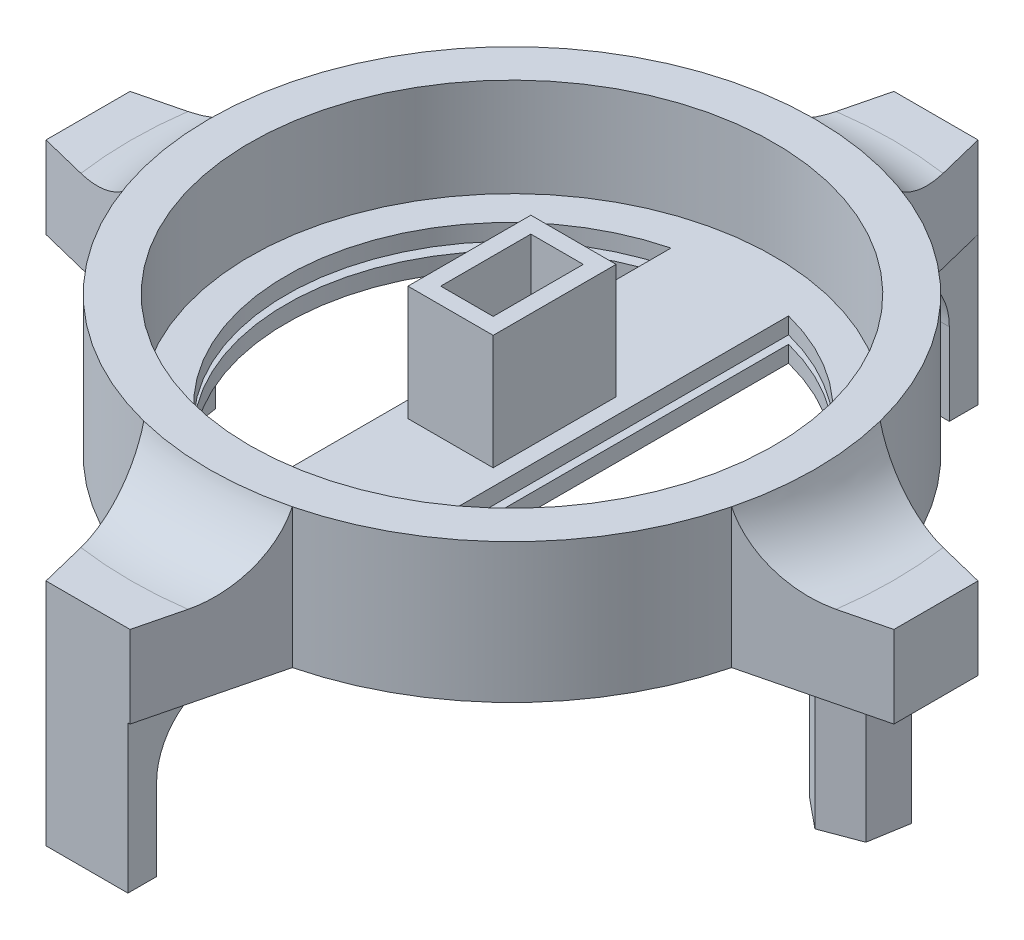
from build123d import *

# Parameters (mm, degrees)
SKETCH4_R                = 17
BOSS_EXTRUDE3_DEPTH      = 6
SHELL4_T                 = 0.5
SKETCH5_W                = 3.2
SKETCH5_H                = 5.5
BOSS_EXTRUDE4_DEPTH      = 8
SHELL5_T                 = 1
BOSS_EXTRUDE6_DEPTH      = 3.5
BOSS_EXTRUDE6_DEPTH_BACK = 1.5
SKETCH7_W                = 5
SKETCH7_H                = 1.75
BOSS_EXTRUDE7_DEPTH      = 9
FILLET3_R                = 5
CUT_EXTRUDE1_DEPTH       = 5
SKETCH13_W               = 3.166032567
SKETCH13_H               = 5.463514234
CUT_EXTRUDE2_DEPTH       = 5
FILLET4_R                = 4
BOSS_EXTRUDE8_DEPTH      = 8


with BuildPart() as part:
    # Sketch4 → Boss-Extrude3 (new body)
    with BuildSketch(Plane(origin=(0, 0, 0), x_dir=(1, 0, 0), z_dir=(0, 1, 0))):
        with Locations(Location((0, -46.79046007, 0), (0, 0, 270))):
            Circle(SKETCH4_R)
    extrude(amount=BOSS_EXTRUDE3_DEPTH)

    # Shell4
    shell4_openings = [part.faces().sort_by_distance(p)[0] for p in [
        (0, 6, 46.79046007),
    ]]
    offset(amount=SHELL4_T, openings=shell4_openings, kind=Kind.INTERSECTION)

    # Sketch5 → Boss-Extrude4 (add)
    with BuildSketch(Plane(origin=(0, 0, 0), x_dir=(1, 0, 0), z_dir=(0, 1, 0))):
        with Locations((0, -46.79046007)):
            Rectangle(SKETCH5_W, SKETCH5_H)
    extrude(amount=BOSS_EXTRUDE4_DEPTH)

    # Shell5
    shell5_openings = [part.faces().sort_by_distance(p)[0] for p in [
        (0, 8, 46.79046007),
    ]]
    offset(amount=SHELL5_T, openings=shell5_openings, kind=Kind.INTERSECTION)

    # Sketch6 → Boss-Extrude6 (add, two sides: drawn at the far end of the back side and taken through both)
    with BuildSketch(Plane(origin=(0, 0, 0), x_dir=(1, 0, 0), z_dir=(0, 1, 0)).offset(-BOSS_EXTRUDE6_DEPTH_BACK)):
        with BuildLine():
            Line((-2.565219646, -72.659781842), (2.565219646, -72.659781842))
            Line((2.565219646, -72.659781842), (4.531236217, -64.726956337))
            ThreePointArc((4.531236217, -64.726956337), (0, -65.29046007), (-4.531236217, -64.726956337))
            Line((-4.531236217, -64.726956337), (-2.565219646, -72.659781842))
        make_face()
        with BuildLine():
            Line((-25.869321772, -44.225240424), (-17.936496267, -42.259223853))
            ThreePointArc((-17.936496267, -42.259223853), (-18.5, -46.79046007), (-17.936496267, -51.321696288))
            Line((-17.936496267, -51.321696288), (-25.869321772, -49.355679717))
            Line((-25.869321772, -49.355679717), (-25.869321772, -44.225240424))
        make_face()
        with BuildLine():
            Line((2.565219646, -20.921138298), (4.531236217, -28.853963803))
            ThreePointArc((4.531236217, -28.853963803), (0, -28.29046007), (-4.531236217, -28.853963803))
            Line((-4.531236217, -28.853963803), (-2.565219646, -20.921138298))
            Line((-2.565219646, -20.921138298), (2.565219646, -20.921138298))
        make_face()
        with BuildLine():
            Line((25.869321772, -49.355679717), (17.936496267, -51.321696288))
            ThreePointArc((17.936496267, -51.321696288), (18.5, -46.79046007), (17.936496267, -42.259223853))
            Line((17.936496267, -42.259223853), (25.869321772, -44.225240424))
            Line((25.869321772, -44.225240424), (25.869321772, -49.355679717))
        make_face()
    extrude(amount=BOSS_EXTRUDE6_DEPTH + BOSS_EXTRUDE6_DEPTH_BACK)

    # Sketch7 → Boss-Extrude7 (add)
    with BuildSketch(Plane(origin=(0, -1.5, 0), x_dir=(-1, 0, 0), z_dir=(0, -1, 0))):
        with Locations((0.065219646, -71.784781842)):
            Rectangle(SKETCH7_W, SKETCH7_H)
        with Locations((-0.065219646, -21.796138298)):
            Rectangle(SKETCH7_W, SKETCH7_H)
    extrude(amount=BOSS_EXTRUDE7_DEPTH)

    # Fillet3
    # the kernel refuses this fillet: 5 mm, written as the material it adds along each edge
    with BuildSketch(Plane(origin=(0, 3.5, 46.79046007), x_dir=(-0.6278344871312538, 0, -0.7783468743231616), z_dir=(0.7783468743231616, 0, -0.6278344871312538))) as fillet3_piece_1_section:
        with BuildLine():
            CenterArc((23.269696007, 5), FILLET3_R, 197.457603124, 72.542396876)
            Line((23.269696007, 0), (23.269696007, -0.1))
            Line((23.269696007, -0.1), (18.5, -0.1))
            Line((18.5, -0.1), (18.4, 0))
            ThreePointArc((18.4, 0), (18.4, 1.75), (18.40460608, 3.47))
            Line((18.40460608, 3.47), (18.5, 3.5))
        make_face()
    fillet3_piece_1 = revolve(axis=Axis((0, 3.5, 46.79046007), (0, 1, 0)), revolution_arc=102.218929963, mode=Mode.PRIVATE)
    fillet3_piece_1 = split(fillet3_piece_1, bisect_by=Plane(origin=(-20.380505818, 4.426759582, 42.864930265), z_dir=(0.24055555302697984, 0, 0.9706353722731745)), keep=Keep.TOP, mode=Mode.PRIVATE)
    fillet3_piece_1 = split(fillet3_piece_1, bisect_by=Plane(origin=(-20.380505744, 4.426759582, 50.715989893), z_dir=(0.24055555302697348, 0, -0.9706353722731761)), keep=Keep.TOP, mode=Mode.PRIVATE)
    add(fillet3_piece_1)
    with BuildSketch(Plane(origin=(0, 3.5, 46.79046007), x_dir=(0.7783347748418207, 0, 0.6278494869568123), z_dir=(0.6278494869568123, 0, -0.7783347748418207))) as fillet3_piece_2_section:
        with BuildLine():
            CenterArc((23.269696007, -5), FILLET3_R, 90, 72.542396876)
            Line((23.269696007, 0), (23.269696007, 0.1))
            Line((23.269696007, 0.1), (18.5, 0.1))
            Line((18.5, 0.1), (18.4, 0))
            ThreePointArc((18.4, 0), (18.4, -1.75), (18.40460608, -3.47))
            Line((18.40460608, -3.47), (18.5, -3.5))
        make_face()
    fillet3_piece_2 = revolve(axis=Axis((0, 3.5, 46.79046007), (0, -1, 0)), revolution_arc=51.108360804, mode=Mode.PRIVATE)
    fillet3_piece_2 = split(fillet3_piece_2, bisect_by=Plane(origin=(4.048850537, 4.426759722, 66.673369956), z_dir=(-0.970635372273176, 0, -0.24055555302697343)), keep=Keep.TOP, mode=Mode.PRIVATE)
    add(fillet3_piece_2)
    with BuildSketch(Plane(origin=(0, 3.5, 46.79046007), x_dir=(0.7783468743230912, 0, -0.6278344871313409), z_dir=(0.6278344871313409, 0, 0.7783468743230912))) as fillet3_piece_3_section:
        with BuildLine():
            CenterArc((23.269696007, 5), FILLET3_R, 197.457603124, 72.542396876)
            Line((23.269696007, 0), (23.269696007, -0.1))
            Line((23.269696007, -0.1), (18.5, -0.1))
            Line((18.5, -0.1), (18.4, 0))
            ThreePointArc((18.4, 0), (18.4, 1.75), (18.40460608, 3.47))
            Line((18.40460608, 3.47), (18.5, 3.5))
        make_face()
    fillet3_piece_3 = revolve(axis=Axis((0, 3.5, 46.79046007), (0, 1, 0)), revolution_arc=102.218929963, mode=Mode.PRIVATE)
    fillet3_piece_3 = split(fillet3_piece_3, bisect_by=Plane(origin=(3.925529805, 4.426759582, 26.409954252), z_dir=(-0.9706353722731743, 0, 0.24055555302698087)), keep=Keep.TOP, mode=Mode.PRIVATE)
    fillet3_piece_3 = split(fillet3_piece_3, bisect_by=Plane(origin=(-3.925529823, 4.426759582, 26.409954326), z_dir=(0.9706353722731764, 0, 0.2405555530269717)), keep=Keep.TOP, mode=Mode.PRIVATE)
    add(fillet3_piece_3)
    with BuildSketch(Plane(origin=(0, 3.5, 46.79046007), x_dir=(0.6278344871312218, 0, 0.7783468743231875), z_dir=(-0.7783468743231875, 0, 0.6278344871312218))) as fillet3_piece_4_section:
        with BuildLine():
            CenterArc((23.269696007, 5), FILLET3_R, 197.457603124, 72.542396876)
            Line((23.269696007, 0), (23.269696007, -0.1))
            Line((23.269696007, -0.1), (18.5, -0.1))
            Line((18.5, -0.1), (18.4, 0))
            ThreePointArc((18.4, 0), (18.4, 1.75), (18.40460608, 3.47))
            Line((18.40460608, 3.47), (18.5, 3.5))
        make_face()
    fillet3_piece_4 = revolve(axis=Axis((0, 3.5, 46.79046007), (0, 1, 0)), revolution_arc=102.218929963, mode=Mode.PRIVATE)
    fillet3_piece_4 = split(fillet3_piece_4, bisect_by=Plane(origin=(20.380505818, 4.426759582, 50.715989875), z_dir=(-0.24055555302698112, 0, -0.9706353722731741)), keep=Keep.TOP, mode=Mode.PRIVATE)
    fillet3_piece_4 = split(fillet3_piece_4, bisect_by=Plane(origin=(20.380505744, 4.426759582, 42.864930247), z_dir=(-0.24055555302697304, 0, 0.9706353722731761)), keep=Keep.TOP, mode=Mode.PRIVATE)
    add(fillet3_piece_4)
    with BuildSketch(Plane(origin=(0, 3.5, 46.79046007), x_dir=(0, 0, 1), z_dir=(1, 0, 0))) as fillet3_piece_5_section:
        with BuildLine():
            CenterArc((23.269696007, -5), FILLET3_R, 90, 72.542396876)
            Line((23.269696007, 0), (23.269696007, 0.1))
            Line((23.269696007, 0.1), (18.5, 0.1))
            Line((18.5, 0.1), (18.4, 0))
            ThreePointArc((18.4, 0), (18.4, -1.75), (18.40460608, -3.47))
            Line((18.40460608, -3.47), (18.5, -3.5))
        make_face()
    fillet3_piece_5 = revolve(axis=Axis((0, 3.5, 46.79046007), (0, -1, 0)), revolution_arc=51.108360804, mode=Mode.PRIVATE)
    fillet3_piece_5 = split(fillet3_piece_5, bisect_by=Plane(origin=(-4.04885046, 4.426759578, 66.673370268), z_dir=(0.9706353722731745, 0, -0.24055555302697917)), keep=Keep.TOP, mode=Mode.PRIVATE)
    add(fillet3_piece_5)

    # Sketch11 → Cut-Extrude1 (cut)
    with BuildSketch(Plane(origin=(0, 1, 0), x_dir=(1, 0, 0), z_dir=(0, 1, 0))):
        with BuildLine():
            Line((-3.585868376, -59.921550203), (-3.585868376, -33.501237191))
            ThreePointArc((-3.585868376, -33.501237191), (-13.861572731, -46.711393697), (-3.585868376, -59.921550203))
        make_face()
        with BuildLine():
            Line((3.585868376, -59.921550203), (3.585868376, -33.501237191))
            ThreePointArc((3.585868376, -33.501237191), (13.861572731, -46.711393697), (3.585868376, -59.921550203))
        make_face()
    extrude(amount=-CUT_EXTRUDE1_DEPTH, mode=Mode.SUBTRACT)

    # Sketch13 → Cut-Extrude2 (cut)
    with BuildSketch(Plane(origin=(0, -0.5, 0), x_dir=(1, 0, 0), z_dir=(0, 1, 0))):
        with Locations((0.016983716, -46.772217187)):
            Rectangle(SKETCH13_W, SKETCH13_H)
    extrude(amount=-CUT_EXTRUDE2_DEPTH, mode=Mode.SUBTRACT)

    # Fillet4
    fillet4_edges = [part.edges().sort_by_distance(p)[0] for p in [
        (0.065219646, -1.5, 22.671138298),
        (-0.065219646, -1.5, 70.909781842),
    ]]
    fillet(fillet4_edges, radius=FILLET4_R)

    # Sketch16 → Boss-Extrude8 (add)
    with BuildSketch(Plane(origin=(0, -1.5, 0), x_dir=(-1, 0, 0), z_dir=(0, -1, 0))):
        Polygon((19.095115037, -47.769177252), (20.96203058, -49.305079029), (23.225618307, -48.456233631), (23.622290493, -46.071486456), (21.75537495, -44.535584679), (19.491787223, -45.384430077), align=None)
        Polygon((-19.525754656, -45.384430077), (-19.12908247, -47.769177252), (-20.995998013, -49.305079029), (-23.25958574, -48.456233631), (-23.656257926, -46.071486456), (-21.789342383, -44.535584679), align=None)
    extrude(amount=BOSS_EXTRUDE8_DEPTH)


solid = part.part
